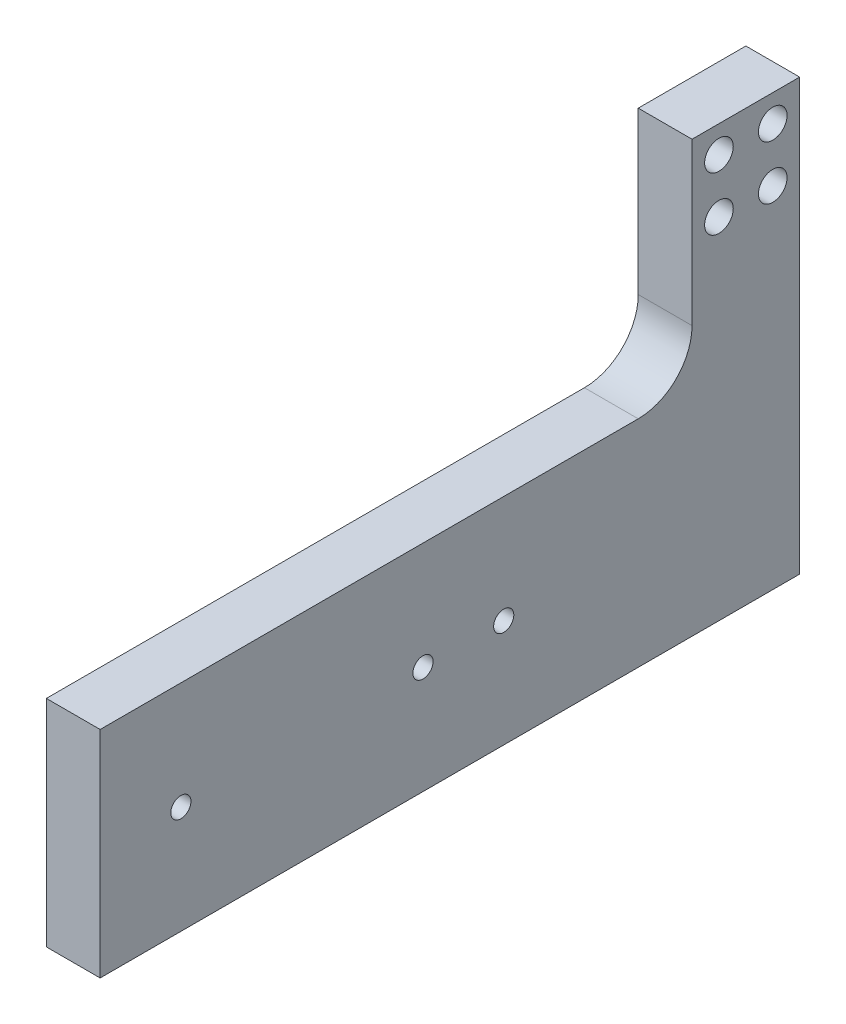
from build123d import *

# Parameters (mm, degrees)
SKETCH1_R               = 2.38125
BOSS_EXTRUDE1_DEPTH     = 12.7
F_1_4_CLEARANCE_HOLE1_D = 6.7564
FILLET1_R               = 12.7


with BuildPart() as part:
    # Sketch1 → Boss-Extrude1 (new body)
    with BuildSketch(Plane(origin=(0, 0, 0), x_dir=(0, 0, -1), z_dir=(1, 0, 0))):
        Polygon((0, 0), (0, 101.6), (-25.4, 101.6), (-25.4, 50.8), (-165.1, 50.8), (-165.1, 0), align=None)
        with Locations((-146.05, 25.4)):
            Circle(SKETCH1_R, mode=Mode.SUBTRACT)
        with Locations((-88.9, 25.4)):
            Circle(SKETCH1_R, mode=Mode.SUBTRACT)
        with Locations((-69.85, 25.4)):
            Circle(SKETCH1_R, mode=Mode.SUBTRACT)
    extrude(amount=BOSS_EXTRUDE1_DEPTH)

    # 1/4 Clearance Hole1 (through all)
    with Locations(Plane(origin=(12.7, 0, 0), x_dir=(0, 0, -1), z_dir=(1, 0, 0))):
        with Locations((-19.05, 95.25), (-6.35, 95.25), (-6.35, 82.55), (-19.05, 82.55)):
            Hole(F_1_4_CLEARANCE_HOLE1_D / 2)

    # Fillet1
    fillet1_edges = [part.edges().sort_by_distance(p)[0] for p in [
        (6.35, 50.8, 25.4),
    ]]
    fillet(fillet1_edges, radius=FILLET1_R)


solid = part.part
